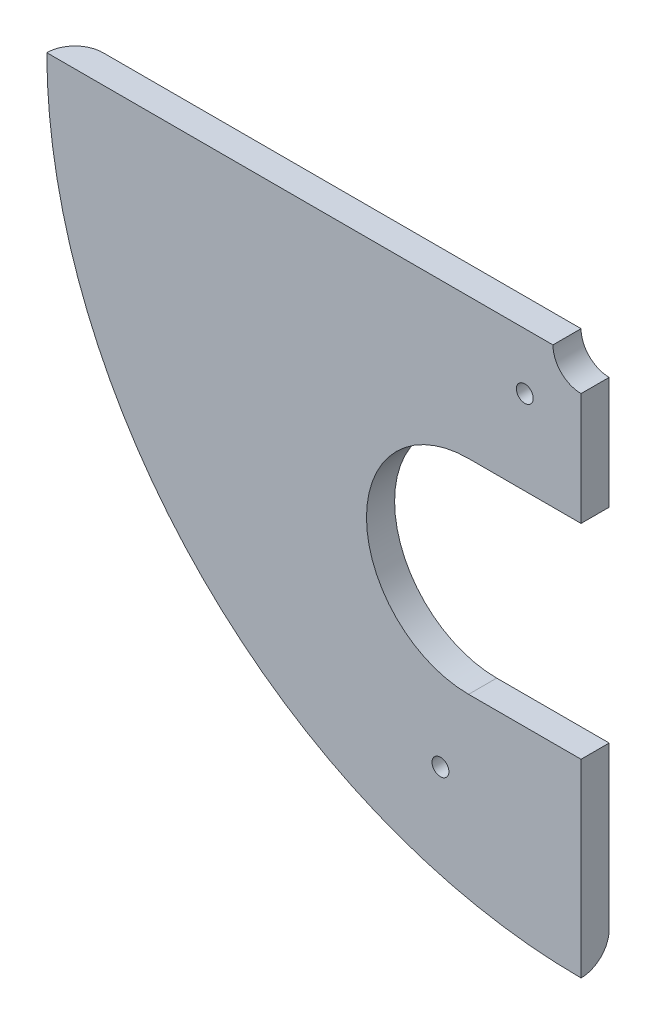
from build123d import *

# Parameters (mm, degrees)
SKETCH_1_R          = 1.5
EXTRUDE_1_DEPTH     = 5
CUT_EXTRUDE_1_DEPTH = 135.443296597
FILLET_2_R          = 5


with BuildPart() as part:
    # 草圖1 → 填料-伸長1 (new body)
    with BuildSketch(Plane.XY):
        with BuildLine():
            Line((-5, 0), (-95, 0))
            ThreePointArc((-95, 0), (-67.175144213, -67.175144213), (0, -95))
            Line((0, -95), (0, -5))
            ThreePointArc((0, -5), (-3.535533906, -3.535533906), (-5, 0))
        make_face()
        with Locations((-10, -10)):
            Circle(SKETCH_1_R, mode=Mode.SUBTRACT)
        with Locations((-25, -75)):
            Circle(SKETCH_1_R, mode=Mode.SUBTRACT)
    extrude(amount=EXTRUDE_1_DEPTH)

    # 草圖2 → 除料-伸長1 (cut, through all)
    with BuildSketch(Plane(origin=(0, 0, 0), x_dir=(-1, 0, 0), z_dir=(0, 0, -1))):
        with BuildLine():
            Line((0, -25), (0, -61.312071511))
            Line((0, -61.312071511), (20, -61.312071511))
            ThreePointArc((20, -61.312071511), (38.156035755, -43.156035755), (20, -25))
            Line((20, -25), (0, -25))
        make_face()
    extrude(amount=-CUT_EXTRUDE_1_DEPTH, mode=Mode.SUBTRACT)

    # 圓角2
    fillet_2_edges = [part.edges().sort_by_distance(p)[0] for p in [
        (-67.175144213, -67.175144213, 0),
    ]]
    fillet(fillet_2_edges, radius=FILLET_2_R - 0.0001)  # a hair under: the kernel refuses the full size


solid = part.part
